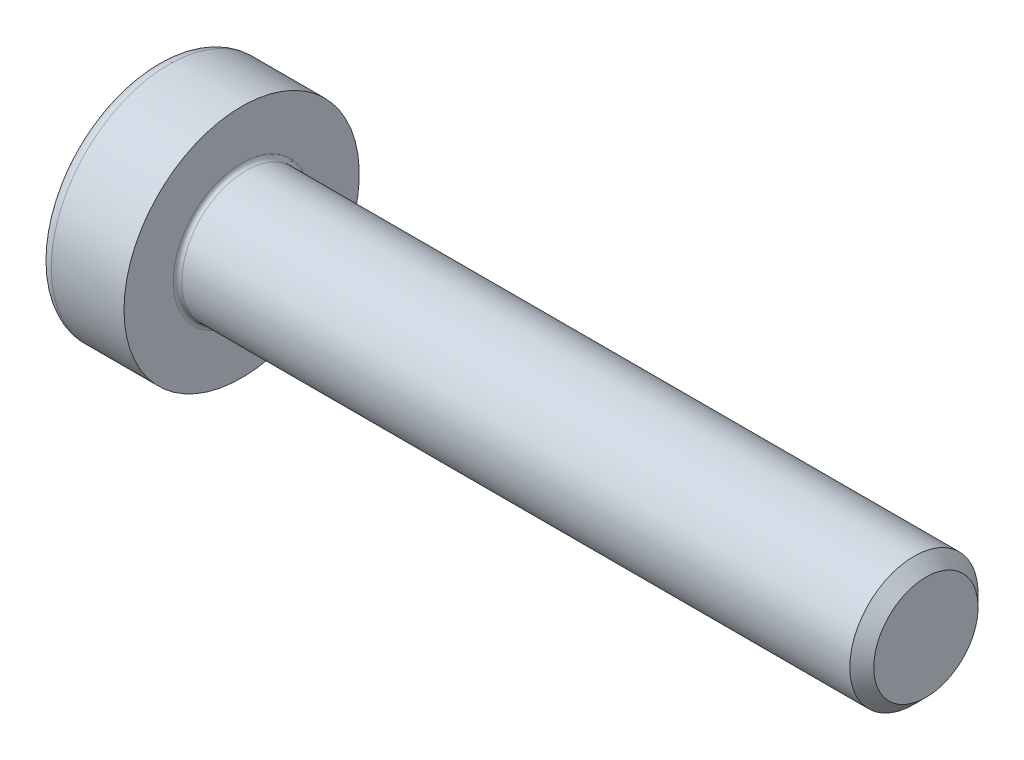
from build123d import *

# Parameters (mm, degrees)
FILLET1_R   = 0.1
FILLET2_R   = 0.3
HEX_2_DEPTH = 1.5


with BuildPart() as part:
    # BodySke → Base-Revolve (revolve)
    with BuildSketch(Plane.XY):
        Polygon((0, 0), (0, 2.75), (2, 2.75), (2, 1.5), (17.7195, 1.5), (18, 1.2195), (18, 0), align=None)
    revolve(axis=Axis((-31.75, 0, 0), (1, 0, 0)))

    # Fillet1
    fillet1_edges = [part.edges().sort_by_distance(p)[0] for p in [
        (2, -1.5, 0),
    ]]
    fillet(fillet1_edges, radius=FILLET1_R)

    # Fillet2
    fillet2_edges = [part.edges().sort_by_distance(p)[0] for p in [
        (0, -2.75, 0),
    ]]
    fillet(fillet2_edges, radius=FILLET2_R)

    # Sketch2 → Hex-PreBroach (revolve, cut)
    with BuildSketch(Plane.XY):
        Polygon((0, 1), (1.5, 1), (2.077350269, 0), (0, 0), align=None)
    revolve(axis=Axis((0, 0, 0), (1, 0, 0)), mode=Mode.SUBTRACT)

    # Sketch3 → Hex 2 (cut)
    with BuildSketch(Plane(origin=(0, 0, 0), x_dir=(0, 0.500000000000001, 0.866025403784438), z_dir=(-1, 0, 0))):
        Polygon((0.577350269, 1), (-0.577350269, 1), (-1.154700538, 0), (-0.577350269, -1), (0.577350269, -1), (1.154700538, 0), align=None)
    extrude(amount=-HEX_2_DEPTH, mode=Mode.SUBTRACT)


solid = part.part
